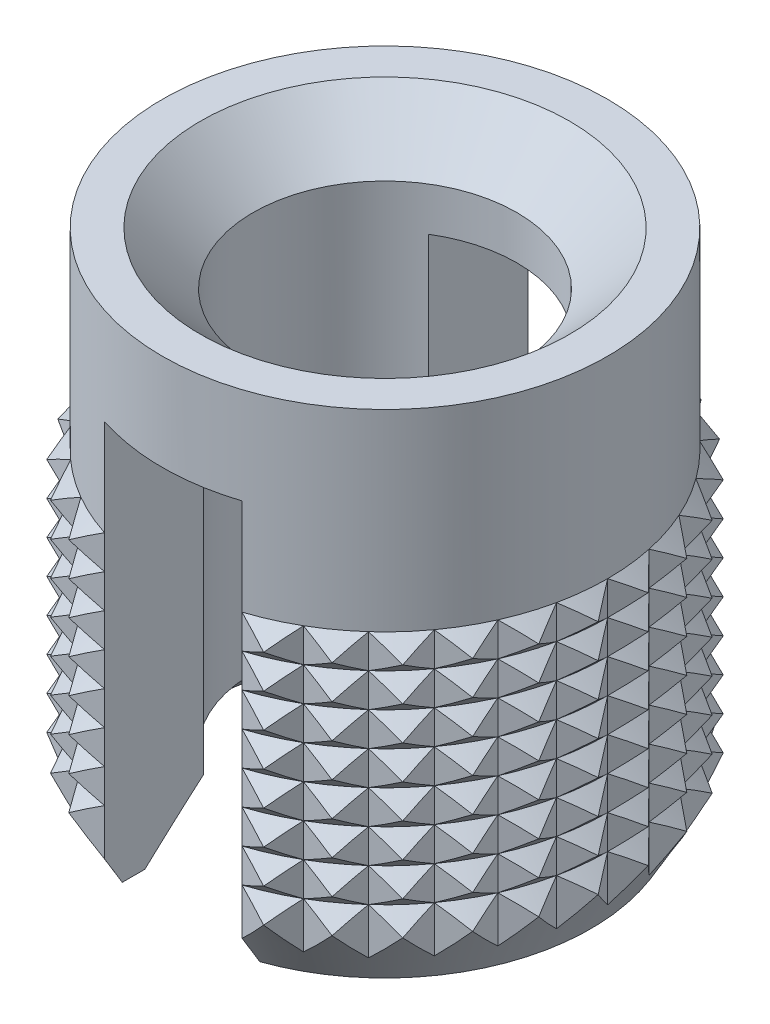
from build123d import *

# Parameters (mm, degrees)
CUT_EXTRUDE1_DEPTH      = 6.757968392
CIRPATTERN1_COUNT       = 30
CUT_EXTRUDE2_DEPTH      = 6.753077297
CUT_EXTRUDE2_DEPTH_BACK = 6.753077297


with BuildPart() as part:
    # Sketch2 → Revolve1 (revolve)
    with BuildSketch(Plane.XY):
        Polygon((-2.11, 4.78), (-2.11, 2.954256258), (-2.27, 2.794256258), (-2.11, 2.634256258), (-2.27, 2.474256258), (-2.11, 2.314256258), (-2.27, 2.154256258), (-2.11, 1.994256258), (-2.27, 1.834256258), (-2.11, 1.674256258), (-2.27, 1.514256258), (-2.11, 1.354256258), (-2.27, 1.194256258), (-2.11, 1.034256258), (-2.27, 0.874256258), (-2.11, 0.714256258), (-2.27, 0.554256258), (-1.95, 0), (-1.75, 0), (-1.25, 0.5), (-1.25, 4.28), (-1.75, 4.78), align=None)
    revolve(axis=Axis((0, 0, 0), (0, 1, 0)))

    # Sketch3 → Cut-Extrude1 (cut, symmetric)
    with BuildSketch(Plane(origin=(0, 4.78, 0), x_dir=(1, 0, 0), z_dir=(0, 1, 0))):
        Polygon((-0.220555057, 2.098441199), (0, 2.27), (0.220555057, 2.098441199), (0.289151629, 2.751093985), (-0.289151629, 2.751093985), align=None)
    cut_extrude1 = extrude(amount=CUT_EXTRUDE1_DEPTH, both=True, mode=Mode.SUBTRACT)

    # CirPattern1: Cut-Extrude1 ×30 about axis
    cirpattern1_axis = Axis((0, 0, 0), (0, -1, 0))
    for i in range(1, CIRPATTERN1_COUNT):
        add(cut_extrude1.rotate(cirpattern1_axis, i * 360 / CIRPATTERN1_COUNT), mode=Mode.SUBTRACT)

    # Sketch4 → Cut-Extrude2 (cut, two sides: drawn at the far end of the back side and taken through both)
    with BuildSketch(Plane.XY.offset(-CUT_EXTRUDE2_DEPTH_BACK)):
        Polygon((-0.652025858, 3.867128129), (0.652025858, 3.867128129), (0.652025858, 2.954256258), (0.652025858, 0), (-0.652025858, 0), align=None)
    extrude(amount=CUT_EXTRUDE2_DEPTH + CUT_EXTRUDE2_DEPTH_BACK, mode=Mode.SUBTRACT)


solid = part.part
